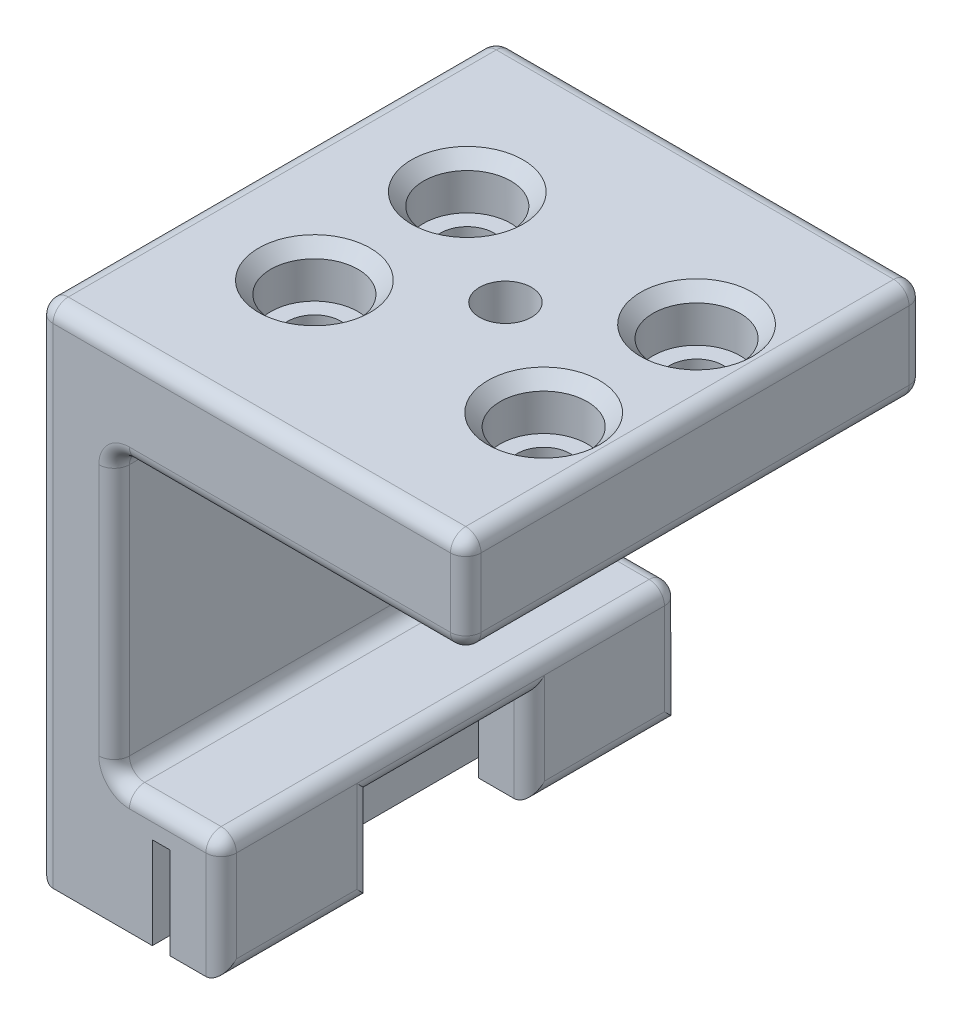
from build123d import *

# Parameters (mm, degrees)
SKETCH1_W           = 23
SKETCH1_H           = 6.5
BOSS_EXTRUDE1_DEPTH = 30
SKETCH2_R           = 1.75
CUT_EXTRUDE1_DEPTH  = 44.295496302
BOSS_EXTRUDE2_DEPTH = 8
BOSS_EXTRUDE4_DEPTH = 8
SKETCH9_W           = 4
SKETCH9_H           = 8
BOSS_EXTRUDE6_DEPTH = 3
SKETCH10_R          = 2.85
CUT_EXTRUDE5_DEPTH  = 3.2
SKETCH12_R          = 1.7
CUT_EXTRUDE6_DEPTH  = 44.295496302
SKETCH12_3_R        = 2.8
SKETCH12_3_R_2      = 1.7
CUT_EXTRUDE7_DEPTH  = 3.2
CHAMFER2_SIZE       = 0.8
SKETCH13_W          = 13
SKETCH13_H          = 2
SKETCH13_W_2        = 4
BOSS_EXTRUDE7_DEPTH = 7.1
SKETCH14_W          = 4
SKETCH14_H          = 10.291911397
CUT_EXTRUDE8_DEPTH  = 6
FILLET1_R           = 1
SKETCH15_W          = 0.5
SKETCH15_H          = 30
CUT_EXTRUDE9_DEPTH  = 6


with BuildPart() as part:
    # Sketch1 → Boss-Extrude1 (new body)
    with BuildSketch(Plane.XY):
        Polygon((-11.5, -29.75), (-11.5, -3.25), (-11.5, 3.25), (-16.5, 3.25), (-16.5, -29.75), align=None)
        Rectangle(SKETCH1_W, SKETCH1_H)
    extrude(amount=BOSS_EXTRUDE1_DEPTH)

    # Sketch2 → Cut-Extrude1 (cut, through all)
    with BuildSketch(Plane.XZ.offset(3.25)):
        with BuildLine():
            ThreePointArc((4.85, 20), (5.362563133, 18.762563133), (6.6, 18.25))
            Line((6.6, 18.25), (6.6, 20))
            Line((6.6, 20), (4.85, 20))
        make_face()
        with BuildLine():
            Line((6.6, 20), (6.6, 18.25))
            ThreePointArc((6.6, 18.25), (7.837436867, 18.762563133), (8.35, 20))
            ThreePointArc((8.35, 20), (6.6, 21.75), (4.85, 20))
            Line((4.85, 20), (6.6, 20))
        make_face()
        with BuildLine():
            ThreePointArc((6.6, 11.75), (5.362563133, 11.237436867), (4.85, 10))
            Line((4.85, 10), (6.6, 10))
            Line((6.6, 10), (6.6, 11.75))
        make_face()
        with BuildLine():
            Line((6.6, 10), (4.85, 10))
            ThreePointArc((4.85, 10), (6.6, 8.25), (8.35, 10))
            ThreePointArc((8.35, 10), (7.837436867, 11.237436867), (6.6, 11.75))
            Line((6.6, 11.75), (6.6, 10))
        make_face()
        with BuildLine():
            Line((-8.4, 11.75), (-8.4, 10))
            Line((-8.4, 10), (-6.65, 10))
            ThreePointArc((-6.65, 10), (-7.162563133, 11.237436867), (-8.4, 11.75))
        make_face()
        with BuildLine():
            Line((-6.65, 10), (-8.4, 10))
            Line((-8.4, 10), (-8.4, 11.75))
            ThreePointArc((-8.4, 11.75), (-9.637436867, 8.762563133), (-6.65, 10))
        make_face()
        with Locations(Location((-8.4, 20, 0), (0, 0, 270))):
            Circle(SKETCH2_R)
    extrude(amount=-CUT_EXTRUDE1_DEPTH, mode=Mode.SUBTRACT)

    # Sketch3 → Boss-Extrude2 (add)
    with BuildSketch(Plane.XZ.offset(29.75)):
        with BuildLine():
            Line((-4.5, 13), (-11.5, 13))
            Line((-11.5, 13), (-11.5, 0))
            Line((-11.5, 0), (-8.5, 0))
            Line((-8.5, 0), (-8.5, 11.528269919))
            Line((-8.5, 11.528269919), (-7.844159723, 11.528269919))
            Line((-7.844159723, 11.528269919), (-7.844159723, 9.379551385))
            ThreePointArc((-7.844159723, 9.379551385), (-7.365127094, 9.180905616), (-7.05, 8.769047247))
            ThreePointArc((-7.05, 8.769047247), (-7.365127094, 8.357188878), (-7.844159723, 8.158543109))
            ThreePointArc((-7.844159723, 8.158543109), (-7.937365917, 8.108731646), (-7.974594506, 8.009824575))
            Line((-7.974594506, 8.009824575), (-7.974594506, 7.528269919))
            ThreePointArc((-7.974594506, 7.528269919), (-7.937365917, 7.429362848), (-7.844159723, 7.379551385))
            ThreePointArc((-7.844159723, 7.379551385), (-7.365127094, 7.180905616), (-7.05, 6.769047247))
            ThreePointArc((-7.05, 6.769047247), (-7.365127094, 6.357188878), (-7.844159723, 6.158543109))
            ThreePointArc((-7.844159723, 6.158543109), (-7.937365917, 6.108731646), (-7.974594506, 6.009824575))
            Line((-7.974594506, 6.009824575), (-7.974594506, 5.528269919))
            ThreePointArc((-7.974594506, 5.528269919), (-7.937365917, 5.429362848), (-7.844159723, 5.379551385))
            ThreePointArc((-7.844159723, 5.379551385), (-7.365127094, 5.180905616), (-7.05, 4.769047247))
            ThreePointArc((-7.05, 4.769047247), (-7.365127094, 4.357188878), (-7.844159723, 4.158543109))
            ThreePointArc((-7.844159723, 4.158543109), (-7.937365917, 4.108731646), (-7.974594506, 4.009824575))
            Line((-7.974594506, 4.009824575), (-7.974594506, 3.528269919))
            ThreePointArc((-7.974594506, 3.528269919), (-7.937365917, 3.429362848), (-7.844159723, 3.379551385))
            ThreePointArc((-7.844159723, 3.379551385), (-7.365127094, 3.180905616), (-7.05, 2.769047247))
            ThreePointArc((-7.05, 2.769047247), (-7.365127094, 2.357188878), (-7.844159723, 2.158543109))
            ThreePointArc((-7.844159723, 2.158543109), (-7.937365917, 2.108731646), (-7.974594506, 2.009824575))
            Line((-7.974594506, 2.009824575), (-7.974594506, 1.528269919))
            ThreePointArc((-7.974594506, 1.528269919), (-7.937365917, 1.429362848), (-7.844159723, 1.379551385))
            ThreePointArc((-7.844159723, 1.379551385), (-7.365127094, 1.180905616), (-7.05, 0.769047247))
            ThreePointArc((-7.05, 0.769047247), (-7.365127094, 0.357188878), (-7.844159723, 0.158543109))
            ThreePointArc((-7.844159723, 0.158543109), (-7.855060169, 0.084538651), (-7.858705191, 0.009824575))
            Line((-7.858705191, 0.009824575), (-7.858705191, 0))
            Line((-7.858705191, 0), (-4.5, 0))
            Line((-4.5, 0), (-4.5, 13))
        make_face()
    extrude(amount=-BOSS_EXTRUDE2_DEPTH)

    # Sketch3<3> → Boss-Extrude4 (add)
    with BuildSketch(Plane.XZ.offset(29.75)):
        with BuildLine():
            Line((-7.844159723, 20.620448615), (-7.844159723, 18.471730081))
            Line((-7.844159723, 18.471730081), (-8.5, 18.471730081))
            Line((-8.5, 18.471730081), (-8.5, 30))
            Line((-8.5, 30), (-11.5, 30))
            Line((-11.5, 30), (-11.5, 17))
            Line((-11.5, 17), (-4.5, 17))
            Line((-4.5, 17), (-4.5, 30))
            Line((-4.5, 30), (-7.858705191, 30))
            Line((-7.858705191, 30), (-7.858705191, 29.990175425))
            ThreePointArc((-7.858705191, 29.990175425), (-7.855060169, 29.915461349), (-7.844159723, 29.841456891))
            ThreePointArc((-7.844159723, 29.841456891), (-7.365127094, 29.642811122), (-7.05, 29.230952753))
            ThreePointArc((-7.05, 29.230952753), (-7.365127094, 28.819094384), (-7.844159723, 28.620448615))
            ThreePointArc((-7.844159723, 28.620448615), (-7.937365917, 28.570637152), (-7.974594506, 28.471730081))
            Line((-7.974594506, 28.471730081), (-7.974594506, 27.990175425))
            ThreePointArc((-7.974594506, 27.990175425), (-7.937365917, 27.891268354), (-7.844159723, 27.841456891))
            ThreePointArc((-7.844159723, 27.841456891), (-7.365127094, 27.642811122), (-7.05, 27.230952753))
            ThreePointArc((-7.05, 27.230952753), (-7.365127094, 26.819094384), (-7.844159723, 26.620448615))
            ThreePointArc((-7.844159723, 26.620448615), (-7.937365917, 26.570637152), (-7.974594506, 26.471730081))
            Line((-7.974594506, 26.471730081), (-7.974594506, 25.990175425))
            ThreePointArc((-7.974594506, 25.990175425), (-7.937365917, 25.891268354), (-7.844159723, 25.841456891))
            ThreePointArc((-7.844159723, 25.841456891), (-7.365127094, 25.642811122), (-7.05, 25.230952753))
            ThreePointArc((-7.05, 25.230952753), (-7.365127094, 24.819094384), (-7.844159723, 24.620448615))
            ThreePointArc((-7.844159723, 24.620448615), (-7.937365917, 24.570637152), (-7.974594506, 24.471730081))
            Line((-7.974594506, 24.471730081), (-7.974594506, 23.990175425))
            ThreePointArc((-7.974594506, 23.990175425), (-7.937365917, 23.891268354), (-7.844159723, 23.841456891))
            ThreePointArc((-7.844159723, 23.841456891), (-7.365127094, 23.642811122), (-7.05, 23.230952753))
            ThreePointArc((-7.05, 23.230952753), (-7.365127094, 22.819094384), (-7.844159723, 22.620448615))
            ThreePointArc((-7.844159723, 22.620448615), (-7.937365917, 22.570637152), (-7.974594506, 22.471730081))
            Line((-7.974594506, 22.471730081), (-7.974594506, 21.990175425))
            ThreePointArc((-7.974594506, 21.990175425), (-7.937365917, 21.891268354), (-7.844159723, 21.841456891))
            ThreePointArc((-7.844159723, 21.841456891), (-7.365127094, 21.642811122), (-7.05, 21.230952753))
            ThreePointArc((-7.05, 21.230952753), (-7.365127094, 20.819094384), (-7.844159723, 20.620448615))
        make_face()
    extrude(amount=-BOSS_EXTRUDE4_DEPTH)

    # Sketch9 → Boss-Extrude6 (add)
    with BuildSketch(Plane(origin=(-11.5, 0, 0), x_dir=(0, 0, -1), z_dir=(1, 0, 0))):
        with Locations((-15, -25.75)):
            Rectangle(SKETCH9_W, SKETCH9_H)
    extrude(amount=BOSS_EXTRUDE6_DEPTH)

    # Sketch10 → Cut-Extrude5 (cut)
    with BuildSketch(Plane(origin=(0, 3.25, 0), x_dir=(1, 0, 0), z_dir=(0, 1, 0))):
        with Locations(Location((-8.4, -10, 0), (0, 0, 180))):
            Circle(SKETCH10_R)
        with Locations(Location((-8.4, -20, 0), (0, 0, 180))):
            Circle(SKETCH10_R)
        with Locations(Location((6.6, -20, 0), (0, 0, 180))):
            Circle(SKETCH10_R)
        with Locations(Location((6.6, -10, 0), (0, 0, 180))):
            Circle(SKETCH10_R)
    extrude(amount=-CUT_EXTRUDE5_DEPTH, mode=Mode.SUBTRACT)

    # Sketch12 → Cut-Extrude6 (cut, through all)
    with BuildSketch(Plane.XZ.offset(3.25)):
        with Locations(Location((-0.9, 15, 0), (0, 0, 270))):
            Circle(SKETCH12_R)
    extrude(amount=-CUT_EXTRUDE6_DEPTH, mode=Mode.SUBTRACT)

    # Sketch12<3> → Cut-Extrude7 (cut)
    with BuildSketch(Plane.XZ.offset(3.25)):
        with Locations(Location((-0.9, 15, 0), (0, 0, 270))):
            Circle(SKETCH12_3_R)
        with Locations(Location((-0.9, 15, 0), (0, 0, 270))):
            Circle(SKETCH12_3_R_2, mode=Mode.SUBTRACT)
    extrude(amount=-CUT_EXTRUDE7_DEPTH, mode=Mode.SUBTRACT)

    # Chamfer2
    chamfer2_edges = [part.edges().sort_by_distance(p)[0] for p in [
        (-5.55, 3.25, 20),
        (9.45, 3.25, 10),
        (9.45, 3.25, 20),
        (-5.55, 3.25, 10),
        (-0.9, -3.25, 17.8),
    ]]
    chamfer(chamfer2_edges, length=CHAMFER2_SIZE)

    # Sketch13 → Boss-Extrude7 (add)
    with BuildSketch(Plane(origin=(-4.5, 0, 0), x_dir=(0, 0, -1), z_dir=(1, 0, 0))):
        with Locations((-23.5, -22.75)):
            Rectangle(SKETCH13_W, SKETCH13_H)
        with Locations((-15, -22.75)):
            Rectangle(SKETCH13_W_2, SKETCH13_H)
        with Locations((-6.5, -22.75)):
            Rectangle(SKETCH13_W, SKETCH13_H)
    extrude(amount=-BOSS_EXTRUDE7_DEPTH)

    # Sketch14 → Cut-Extrude8 (cut)
    with BuildSketch(Plane.XZ.offset(29.75)):
        with Locations((-6.5, 14.97908148)):
            Rectangle(SKETCH14_W, SKETCH14_H)
    extrude(amount=-CUT_EXTRUDE8_DEPTH, mode=Mode.SUBTRACT)

    # Fillet1
    fillet1_edges = [part.edges().sort_by_distance(p)[0] for p in [
        (-16.5, -13.25, 0),
        (-2.5, 3.25, 0),
        (-16.5, -13.25, 30),
        (11.5, 3.25, 15),
        (-4.5, -29.75, 25.06251859),
        (-4.5, -25.75, 30),
        (11.5, -3.25, 15),
        (-11.5, -3.25, 15),
        (-16.5, -29.75, 15),
        (-16.5, 3.25, 15),
        (-8, -21.75, 30),
        (-11.5, -12.5, 30),
        (0, -3.25, 30),
        (11.5, 0, 30),
        (-4.5, -23.75, 14.979081481),
        (-4.5, -26.75, 20.125037179),
        (-4.5, -26.75, 9.833125782),
        (-2.5, 3.25, 30),
        (-8, -21.75, 0),
        (-4.5, -21.75, 15),
        (-4.5, -25.75, 0),
        (-11.5, -21.75, 15),
        (-4.5, -29.75, 4.916562891),
        (11.5, 0, 0),
        (0, -3.25, 0),
        (-11.5, -12.5, 0),
    ]]
    fillet(fillet1_edges, radius=FILLET1_R - 0.0001)  # a hair under: the kernel refuses the full size

    # Sketch15 → Cut-Extrude9 (cut)
    with BuildSketch(Plane.XZ.offset(29.75)):
        with Locations((-8.75, 15)):
            Rectangle(SKETCH15_W, SKETCH15_H)
    extrude(amount=-CUT_EXTRUDE9_DEPTH, mode=Mode.SUBTRACT)


solid = part.part
